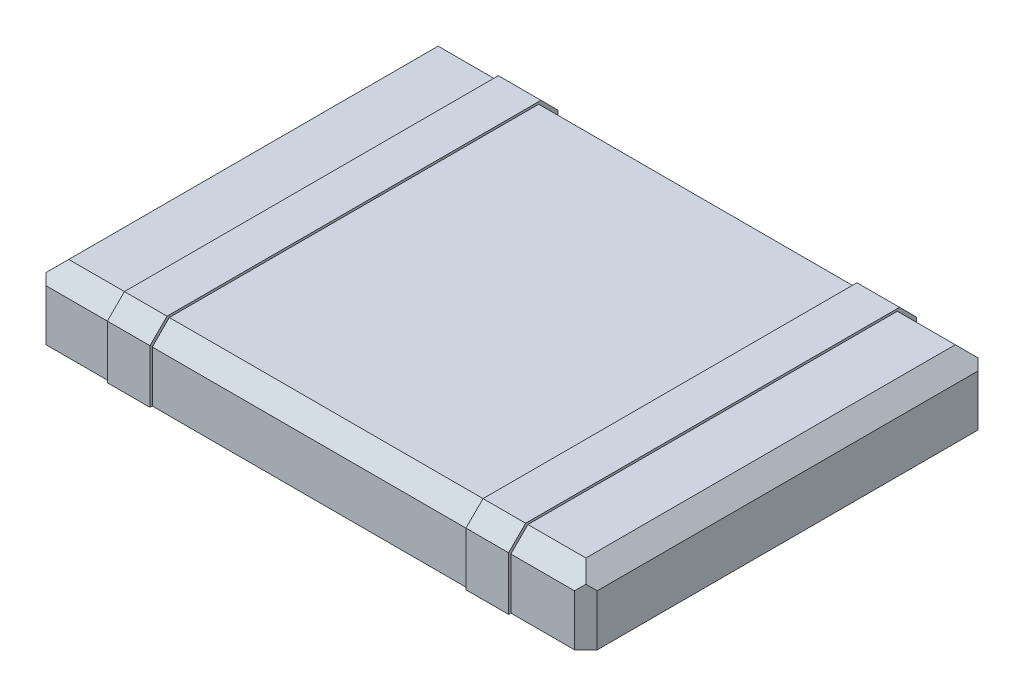
from build123d import *

# Parameters (mm, degrees)
CROQUIS1_W              = 48.5
CROQUIS1_H              = 35.5
SALIENTE_EXTRUIR1_DEPTH = 6
CHAFL_N1_SIZE           = 1
CROQUIS3_W              = 3.75
CROQUIS3_H              = 35.5
SALIENTE_EXTRUIR3_DEPTH = 0.2
CROQUIS4_W              = 3.75
CROQUIS4_H              = 6.2
SALIENTE_EXTRUIR4_DEPTH = 0.2
CROQUIS2_W              = 44.5
CROQUIS2_H              = 32
CORTAR_EXTRUIR1_DEPTH   = 4
CHAFL_N2_SIZE           = 1.5
SALIENTE_EXTRUIR5_DEPTH = 11.5
CROQUIS6_R              = 0.5
SALIENTE_EXTRUIR6_DEPTH = 1.15


with BuildPart() as part:
    # Croquis1 → Saliente-Extruir1 (new body)
    with BuildSketch(Plane(origin=(19.920493139, 0, 21.30129266), x_dir=(1, 0, 0), z_dir=(0, 1, 0))):
        with Locations((-19.920493139, 21.30129266)):
            Rectangle(CROQUIS1_W, CROQUIS1_H)
    extrude(amount=SALIENTE_EXTRUIR1_DEPTH)

    # Chaflán1
    chafl_n1_edges = [part.edges().sort_by_distance(p)[0] for p in [
        (24.25, 3, 17.75),
        (-24.25, 3, 17.75),
        (-24.25, 3, -17.75),
        (24.25, 3, -17.75),
    ]]
    chamfer(chafl_n1_edges, length=CHAFL_N1_SIZE)

    # Croquis3 → Saliente-Extruir3 (add)
    with BuildSketch(Plane(origin=(0, 6, 0), x_dir=(1, 0, 0), z_dir=(0, 1, 0))):
        with Locations((15.775, 0)):
            Rectangle(CROQUIS3_W, CROQUIS3_H)
        with Locations((-15.775, 0)):
            Rectangle(CROQUIS3_W, CROQUIS3_H)
    extrude(amount=SALIENTE_EXTRUIR3_DEPTH)

    # Croquis4 → Saliente-Extruir4 (add)
    with BuildSketch(Plane.XY.offset(17.75)):
        with Locations((15.775, 3.1)):
            Rectangle(CROQUIS4_W, CROQUIS4_H)
        with Locations((-15.775, 3.1)):
            Rectangle(CROQUIS4_W, CROQUIS4_H)
    saliente_extruir4 = extrude(amount=SALIENTE_EXTRUIR4_DEPTH)

    # Croquis2 → Cortar-Extruir1 (cut)
    with BuildSketch(Plane.XZ):
        Rectangle(CROQUIS2_W, CROQUIS2_H)
    extrude(amount=-CORTAR_EXTRUIR1_DEPTH, mode=Mode.SUBTRACT)

    # Simetría1: Saliente-Extruir4 across plane
    add(saliente_extruir4.mirror(Plane.XY))

    # Chaflán2
    # the kernel refuses this chamfer: 1.5 mm, written as the material it takes off along each edge
    with BuildSketch(Plane(origin=(-21.507524482, 6.2, -17.95), x_dir=(0, 0.02749587661058619, 0.9996219169112968), z_dir=(1, 0, 0)), Plane(origin=(21.507524482, 6.2, -17.95), x_dir=(0, -0.9996219169112968, -0.02749587661058678), z_dir=(-1, 0, 0)), Plane(origin=(-21.507524482, 6.2, 17.95), x_dir=(0, -0.9996219169112968, 0.02749587661058678), z_dir=(1, 0, 0)), Plane(origin=(21.507524482, 6.2, 17.95), x_dir=(0, 0.02749587661058619, -0.9996219169112968), z_dir=(-1, 0, 0))) as chafl_n2_piece_1:
        Polygon((CHAFL_N2_SIZE * 0.999621916911, CHAFL_N2_SIZE * 0.0274958766106), (-CHAFL_N2_SIZE * 0.0274958766106, CHAFL_N2_SIZE * 0.999621916911), (0, 0), align=None)
    extrude(amount=11.465048964, mode=Mode.SUBTRACT)
    with BuildSketch(Plane(origin=(24.25, 6, -20.607524482), x_dir=(0.02749587661058678, -0.9996219169112968, 0), z_dir=(0, 0, 1)), Plane(origin=(-24.25, 6, 20.607524482), x_dir=(-0.02749587661058678, -0.9996219169112968, 0), z_dir=(0, 0, -1))) as chafl_n2_piece_2:
        Polygon((CHAFL_N2_SIZE * 0.999621916911, -CHAFL_N2_SIZE * 0.0274958766106), (-CHAFL_N2_SIZE * 0.0274958766106, -CHAFL_N2_SIZE * 0.999621916911), (0, 0), align=None)
    extrude(amount=41.215048964, mode=Mode.SUBTRACT)
    with BuildSketch(Plane(origin=(27.107524482, 6, 17.75), x_dir=(0, 0.02749587661058619, -0.9996219169112968), z_dir=(-1, 0, 0))) as chafl_n2_piece_3:
        Polygon((CHAFL_N2_SIZE * 0.999621916911, CHAFL_N2_SIZE * 0.0274958766106), (-CHAFL_N2_SIZE * 0.0274958766106, CHAFL_N2_SIZE * 0.999621916911), (0, 0), align=None)
    extrude(amount=9.457524482, mode=Mode.SUBTRACT)
    with BuildSketch(Plane(origin=(27.107524482, 6, 17.75), x_dir=(0, 0.02749587661058619, -0.9996219169112968), z_dir=(-1, 0, 0))) as chafl_n2_piece_4_section:
        Polygon((CHAFL_N2_SIZE * 0.999621916911, CHAFL_N2_SIZE * 0.0274958766106), (-CHAFL_N2_SIZE * 0.0274958766106, CHAFL_N2_SIZE * 0.999621916911), (0, 0), align=None)
    chafl_n2_piece_4 = extrude(amount=13.315048964, mode=Mode.PRIVATE)
    chafl_n2_piece_4 = split(chafl_n2_piece_4, bisect_by=Plane(origin=(13.9, 5.50530956, 17.25530956), z_dir=(-1, 0, 0)), keep=Keep.TOP, mode=Mode.PRIVATE)
    add(chafl_n2_piece_4, mode=Mode.SUBTRACT)
    with BuildSketch(Plane(origin=(13.792475518, 6, -17.75), x_dir=(0, -0.9996219169112968, -0.02749587661058678), z_dir=(1, 0, 0))) as chafl_n2_piece_5_section:
        Polygon((CHAFL_N2_SIZE * 0.999621916911, -CHAFL_N2_SIZE * 0.0274958766106), (-CHAFL_N2_SIZE * 0.0274958766106, -CHAFL_N2_SIZE * 0.999621916911), (0, 0), align=None)
    chafl_n2_piece_5 = extrude(amount=13.315048964, mode=Mode.PRIVATE)
    chafl_n2_piece_5 = split(chafl_n2_piece_5, bisect_by=Plane(origin=(13.9, 5.50530956, -17.25530956), z_dir=(-1, 0, 0)), keep=Keep.TOP, mode=Mode.PRIVATE)
    add(chafl_n2_piece_5, mode=Mode.SUBTRACT)
    with BuildSketch(Plane(origin=(17.65, 6, -17.75), x_dir=(0, -0.9996219169112968, -0.02749587661058678), z_dir=(1, 0, 0)), Plane(origin=(-27.107524482, 6, -17.75), x_dir=(0, -0.9996219169112968, -0.02749587661058678), z_dir=(1, 0, 0)), Plane(origin=(-17.65, 6, 17.75), x_dir=(0, -0.9996219169112968, 0.02749587661058678), z_dir=(-1, 0, 0))) as chafl_n2_piece_6:
        Polygon((CHAFL_N2_SIZE * 0.999621916911, -CHAFL_N2_SIZE * 0.0274958766106), (-CHAFL_N2_SIZE * 0.0274958766106, -CHAFL_N2_SIZE * 0.999621916911), (0, 0), align=None)
    extrude(amount=9.457524482, mode=Mode.SUBTRACT)
    with BuildSketch(Plane(origin=(-17.757524482, 6, -17.75), x_dir=(0, -0.9996219169112968, -0.02749587661058678), z_dir=(1, 0, 0))) as chafl_n2_piece_7_section:
        Polygon((CHAFL_N2_SIZE * 0.999621916911, -CHAFL_N2_SIZE * 0.0274958766106), (-CHAFL_N2_SIZE * 0.0274958766106, -CHAFL_N2_SIZE * 0.999621916911), (0, 0), align=None)
    chafl_n2_piece_7 = extrude(amount=31.657524482, mode=Mode.PRIVATE)
    chafl_n2_piece_7 = split(chafl_n2_piece_7, bisect_by=Plane(origin=(-17.65, 5.50530956, -17.25530956), z_dir=(-1, 0, 0)), keep=Keep.TOP, mode=Mode.PRIVATE)
    add(chafl_n2_piece_7, mode=Mode.SUBTRACT)
    with BuildSketch(Plane(origin=(-13.9, 6, -17.75), x_dir=(0, -0.9996219169112968, -0.02749587661058678), z_dir=(1, 0, 0)), Plane(origin=(13.9, 6, 17.75), x_dir=(0, -0.9996219169112968, 0.02749587661058678), z_dir=(-1, 0, 0))) as chafl_n2_piece_8:
        Polygon((CHAFL_N2_SIZE * 0.999621916911, -CHAFL_N2_SIZE * 0.0274958766106), (-CHAFL_N2_SIZE * 0.0274958766106, -CHAFL_N2_SIZE * 0.999621916911), (0, 0), align=None)
    extrude(amount=27.8, mode=Mode.SUBTRACT)
    with BuildSketch(Plane(origin=(-13.9, 6, -17.75), x_dir=(0, -0.9996219169112968, -0.02749587661058678), z_dir=(1, 0, 0))) as chafl_n2_piece_9_section:
        Polygon((CHAFL_N2_SIZE * 0.999621916911, -CHAFL_N2_SIZE * 0.0274958766106), (-CHAFL_N2_SIZE * 0.0274958766106, -CHAFL_N2_SIZE * 0.999621916911), (0, 0), align=None)
    chafl_n2_piece_9 = extrude(amount=31.657524482, mode=Mode.PRIVATE)
    chafl_n2_piece_9 = split(chafl_n2_piece_9, bisect_by=Plane(origin=(17.65, 5.50530956, -17.25530956), z_dir=(1, 0, 0)), keep=Keep.TOP, mode=Mode.PRIVATE)
    add(chafl_n2_piece_9, mode=Mode.SUBTRACT)
    with BuildSketch(Plane(origin=(-27.107524482, 6, -17.75), x_dir=(0, -0.9996219169112968, -0.02749587661058678), z_dir=(1, 0, 0))) as chafl_n2_piece_10_section:
        Polygon((CHAFL_N2_SIZE * 0.999621916911, -CHAFL_N2_SIZE * 0.0274958766106), (-CHAFL_N2_SIZE * 0.0274958766106, -CHAFL_N2_SIZE * 0.999621916911), (0, 0), align=None)
    chafl_n2_piece_10 = extrude(amount=13.315048964, mode=Mode.PRIVATE)
    chafl_n2_piece_10 = split(chafl_n2_piece_10, bisect_by=Plane(origin=(-13.9, 5.50530956, -17.25530956), z_dir=(1, 0, 0)), keep=Keep.TOP, mode=Mode.PRIVATE)
    add(chafl_n2_piece_10, mode=Mode.SUBTRACT)
    with BuildSketch(Plane(origin=(-13.792475518, 6, 17.75), x_dir=(0, -0.9996219169112968, 0.02749587661058678), z_dir=(-1, 0, 0))) as chafl_n2_piece_11_section:
        Polygon((CHAFL_N2_SIZE * 0.999621916911, -CHAFL_N2_SIZE * 0.0274958766106), (-CHAFL_N2_SIZE * 0.0274958766106, -CHAFL_N2_SIZE * 0.999621916911), (0, 0), align=None)
    chafl_n2_piece_11 = extrude(amount=13.315048964, mode=Mode.PRIVATE)
    chafl_n2_piece_11 = split(chafl_n2_piece_11, bisect_by=Plane(origin=(-13.9, 5.50530956, 17.25530956), z_dir=(1, 0, 0)), keep=Keep.TOP, mode=Mode.PRIVATE)
    add(chafl_n2_piece_11, mode=Mode.SUBTRACT)
    with BuildSketch(Plane(origin=(17.757524482, 6, 17.75), x_dir=(0, -0.9996219169112968, 0.02749587661058678), z_dir=(-1, 0, 0))) as chafl_n2_piece_12_section:
        Polygon((CHAFL_N2_SIZE * 0.999621916911, -CHAFL_N2_SIZE * 0.0274958766106), (-CHAFL_N2_SIZE * 0.0274958766106, -CHAFL_N2_SIZE * 0.999621916911), (0, 0), align=None)
    chafl_n2_piece_12 = extrude(amount=31.657524482, mode=Mode.PRIVATE)
    chafl_n2_piece_12 = split(chafl_n2_piece_12, bisect_by=Plane(origin=(17.65, 5.50530956, 17.25530956), z_dir=(1, 0, 0)), keep=Keep.TOP, mode=Mode.PRIVATE)
    add(chafl_n2_piece_12, mode=Mode.SUBTRACT)
    with BuildSketch(Plane(origin=(13.9, 6, 17.75), x_dir=(0, -0.9996219169112968, 0.02749587661058678), z_dir=(-1, 0, 0))) as chafl_n2_piece_13_section:
        Polygon((CHAFL_N2_SIZE * 0.999621916911, -CHAFL_N2_SIZE * 0.0274958766106), (-CHAFL_N2_SIZE * 0.0274958766106, -CHAFL_N2_SIZE * 0.999621916911), (0, 0), align=None)
    chafl_n2_piece_13 = extrude(amount=31.657524482, mode=Mode.PRIVATE)
    chafl_n2_piece_13 = split(chafl_n2_piece_13, bisect_by=Plane(origin=(-17.65, 5.50530956, 17.25530956), z_dir=(-1, 0, 0)), keep=Keep.TOP, mode=Mode.PRIVATE)
    add(chafl_n2_piece_13, mode=Mode.SUBTRACT)


with BuildPart() as body_2:
    # Croquis5 → Saliente-Extruir5 (new, symmetric)
    with BuildSketch(Plane(origin=(0, 0, 0), x_dir=(0, 0, -1), z_dir=(1, 0, 0))):
        with BuildLine():
            Line((17.95, 1.502646226), (19.588178522, -0.237858692))
            ThreePointArc((19.588178522, -0.237858692), (19.685565736, -1.978315216), (17.95, -1.815573833))
            Line((17.95, -1.815573833), (17.95, 1.502646226))
        make_face()
    extrude(amount=SALIENTE_EXTRUIR5_DEPTH, both=True)

    # Croquis6 → Saliente-Extruir6 (add, symmetric)
    with BuildSketch(Plane.ZY.offset(11.5)):
        with Locations(Location((-18.88782273, -1.15, 0), (0, 0, 180))):
            Circle(CROQUIS6_R)
    saliente_extruir6 = extrude(amount=SALIENTE_EXTRUIR6_DEPTH, both=True)

    # Simetría2: Saliente-Extruir6 across plane
    add(saliente_extruir6.mirror(Plane(origin=(0, 0, 0), x_dir=(0, 0, 1), z_dir=(1, 0, 0))))


solid = Compound([part.part, body_2.part])
